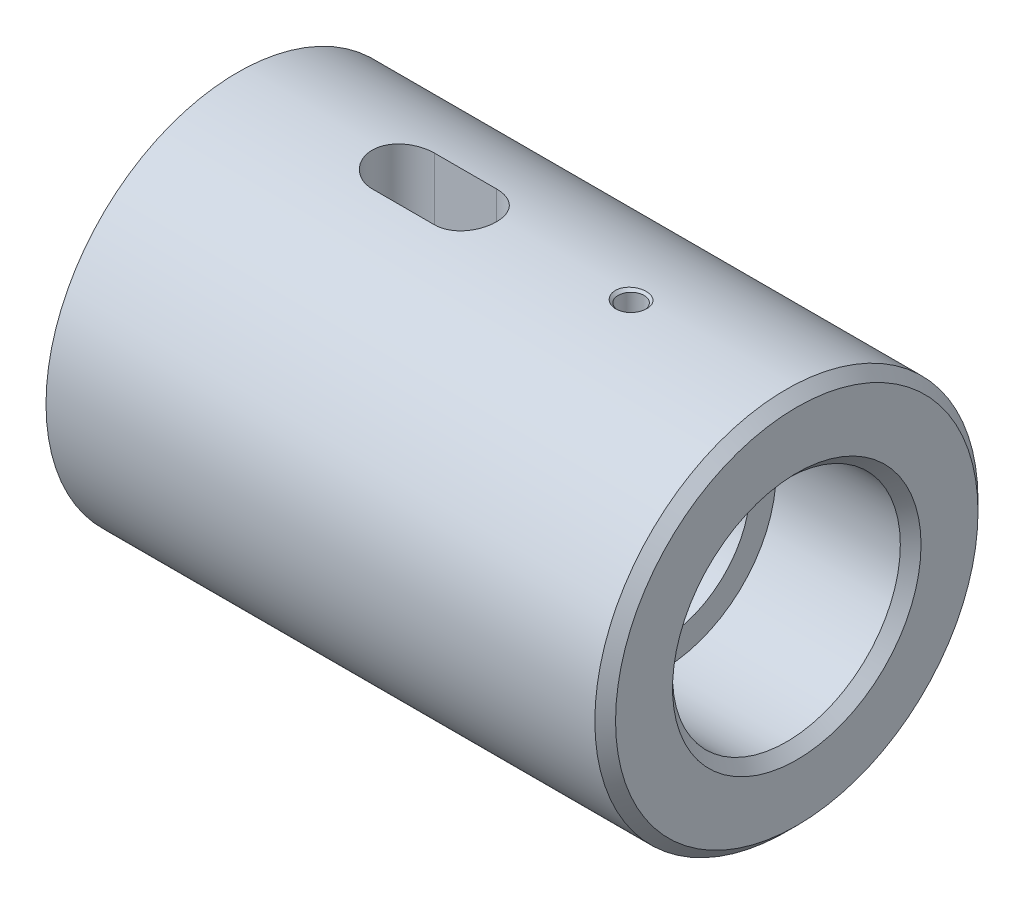
from build123d import *

# Parameters (mm, degrees)
SKETCH_1_R            = 18.5
EXTRUDE_312_DEPTH     = 54
SKETCH_2_R            = 8.5
CUT_EXTRUDE_18_DEPTH  = 61.004166522
SKETCH_3_R            = 11
CUT_EXTRUDE_22_DEPTH  = 35
CUT_EXTRUDE_722_DEPTH = 61.004166522
HOLE_WIZARD_M3_D      = 2.5
HOLE_WIZARD_M3_DEPTH  = 22.5
HOLE_WIZARD_M3_TIP    = 0.751075774
CUT_EXTRUDE_START     = -13
SKETCH_10_R           = 11
CUT_EXTRUDE_1_DEPTH   = 13
CHAMFER_1_SIZE        = 1


# Read off the part's stored shape, not the designer's step: Масленка M3
with BuildPart() as part:
    # Эскиз1 → Extrude 312 (new body)
    with BuildSketch(Plane(origin=(0, 0, 0), x_dir=(0, 0, -1), z_dir=(1, 0, 0))):
        Circle(SKETCH_1_R)
    extrude(amount=-EXTRUDE_312_DEPTH)

    # Эскиз2 → Вырез18 (cut, through all)
    with BuildSketch(Plane(origin=(0, 0, 0), x_dir=(0, 0, -1), z_dir=(1, 0, 0))):
        Circle(SKETCH_2_R)
    extrude(amount=-CUT_EXTRUDE_18_DEPTH, mode=Mode.SUBTRACT)

    # Эскиз3 → Вырез22 (cut)
    with BuildSketch(Plane.ZY.offset(54)):
        Circle(SKETCH_3_R)
    extrude(amount=-CUT_EXTRUDE_22_DEPTH, mode=Mode.SUBTRACT)

    # Эскиз4 → Cut-Extrude 722 (cut, through all)
    with BuildSketch(Plane(origin=(0, 0, 0), x_dir=(1, 0, 0), z_dir=(0, 1, 0))):
        with BuildLine():
            Line((-38, 3), (-32, 3))
            ThreePointArc((-32, 3), (-29, 0), (-32, -3))
            Line((-32, -3), (-38, -3))
            ThreePointArc((-38, -3), (-41, 0), (-38, 3))
        make_face()
    extrude(amount=CUT_EXTRUDE_722_DEPTH, mode=Mode.SUBTRACT)

    # Hole Wizard M3
    with Locations(Plane.ZY.offset(54)):
        with Locations((-12.773874706, 7.375), (-12.773874706, -7.375), (12.773874706, 7.375), (12.773874706, -7.375)):
            Hole(HOLE_WIZARD_M3_D / 2, depth=HOLE_WIZARD_M3_DEPTH)
            with Locations((0, 0, -(HOLE_WIZARD_M3_DEPTH + HOLE_WIZARD_M3_TIP / 2))):  # 118° drill point
                Cone(0, HOLE_WIZARD_M3_D / 2, HOLE_WIZARD_M3_TIP, mode=Mode.SUBTRACT)

    # Эскиз10 → Вырез-Вытянуть1 (cut)
    with BuildSketch(Plane(origin=(0, 0, 0), x_dir=(0, 0, -1), z_dir=(1, 0, 0)).offset(CUT_EXTRUDE_START)):
        with Locations(Location((0, 0, 0), (0, 0, 180))):
            Circle(SKETCH_10_R)
    extrude(amount=CUT_EXTRUDE_1_DEPTH, mode=Mode.SUBTRACT)

    # Фаска1
    chamfer_1_edges = [part.edges().sort_by_distance(p)[0] for p in [
        (-54, 0, -11),
        (0, 0, 18.5),
        (0, 0, -11),
    ]]
    chamfer(chamfer_1_edges, length=CHAMFER_1_SIZE)

    # Hole Wizard M3 2 outline → Hole Wizard M3 2 (revolve, cut)
    with BuildSketch(Plane(origin=(-16, 0, 0), x_dir=(1, 0, 0), z_dir=(0, 0, 1))):
        Polygon((1.12540101, 18.500010757), (1.12540101, 8.425110656), (1.250001052, 8.500000632), (1.25, 18.225), (1.25, 18.500010757), align=None)
        Polygon((0, 8.425110656), (1.125382105, 8.425110656), (1.12540101, 18.500010757), (0, 18.500010757), align=None)
        Polygon((1.25, 18.500010757), (1.25, 18.225), (1.525010757, 18.500010757), align=None)
    revolve(axis=Axis((-16, 0, 0), (0, 1, 0)), mode=Mode.SUBTRACT)


solid = part.part
